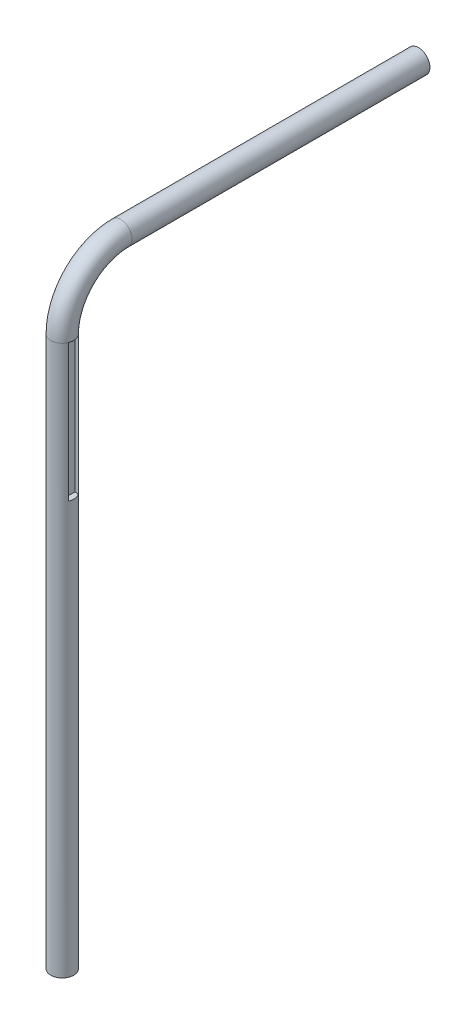
from build123d import *

# Parameters (mm, degrees)
SKETCH3_R           = 12.7
SKETCH3_R_2         = 4.7625
SKETCH4_R           = 12.7
SKETCH4_R_2         = 4.7625
BOSS_EXTRUDE3_DEPTH = 609.6
SKETCH5_R           = 12.7
SKETCH5_R_2         = 4.7625
BOSS_EXTRUDE4_DEPTH = 330.2
SKETCH7_W           = 12.7
SKETCH7_H           = 152.4
CUT_EXTRUDE2_DEPTH  = 6.35


with BuildPart() as part:
    # Sweep1: sweep along a path in Sketch2
    with BuildLine(Plane(origin=(0, 0, 0), x_dir=(0, 0, -1), z_dir=(1, 0, 0))) as sweep1_path:
        ThreePointArc((-64.833774642, 0), (-45.844401699, 45.844401699), (0, 64.833774642))
    # Sketch3 → Sweep1 (sweep)
    with BuildSketch(Plane(origin=(0, 0, 0), x_dir=(1, 0, 0), z_dir=(0, 1, 0))):
        with Locations((0, -64.833774642)):
            Circle(SKETCH3_R)
        with Locations((0, -64.833774642)):
            Circle(SKETCH3_R_2, mode=Mode.SUBTRACT)
    sweep(path=sweep1_path.line)

    # Sketch4 → Boss-Extrude3 (add)
    with BuildSketch(Plane(origin=(0, 0, 0), x_dir=(-1, 0, 0), z_dir=(0, -1, 0))):
        with Locations((0, -64.833774642)):
            Circle(SKETCH4_R)
        with Locations((0, -64.833774642)):
            Circle(SKETCH4_R_2, mode=Mode.SUBTRACT)
    extrude(amount=BOSS_EXTRUDE3_DEPTH)

    # Sketch5 → Boss-Extrude4 (add)
    with BuildSketch(Plane(origin=(0, 0, 0), x_dir=(-1, 0, 0), z_dir=(0, 0, -1))):
        with Locations((0, 64.833774642)):
            Circle(SKETCH5_R)
        with Locations((0, 64.833774642)):
            Circle(SKETCH5_R_2, mode=Mode.SUBTRACT)
    extrude(amount=BOSS_EXTRUDE4_DEPTH)

    # Sketch7 → Cut-Extrude2 (cut)
    with BuildSketch(Plane(origin=(12.7, 0, 0), x_dir=(0, 0, -1), z_dir=(1, 0, 0))):
        with Locations((-63.5, -76.2)):
            Rectangle(SKETCH7_W, SKETCH7_H)
    extrude(amount=-CUT_EXTRUDE2_DEPTH, mode=Mode.SUBTRACT)


solid = part.part
